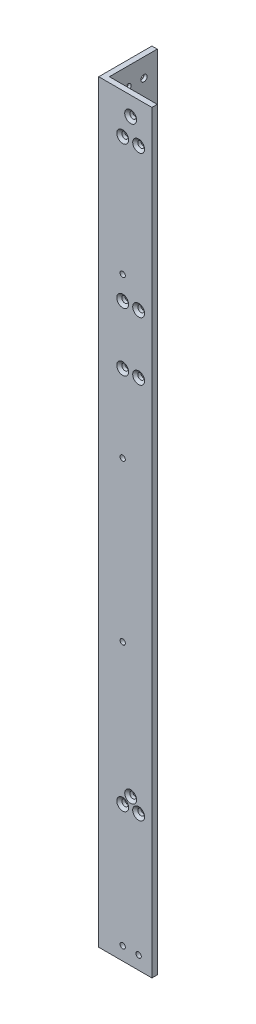
from build123d import *

# Parameters (mm, degrees)
BOSS_EXTRUDE1_DEPTH                               = 450
LEFTSIDEHOLES_SKETCH3_R                           = 1.5875
LEFTSIDEHOLES_CUT_EXTRUDE1_DEPTH                  = 3.175
BACKSIDEHOLES_SKETCH4_R                           = 1.5875
BACKSIDEHOLES_CUT_EXTRUDE2_DEPTH                  = 3.175
CSK_FOR_6_FLAT_HEAD_MACHINE_SCREW_100_D           = 3.7973
CSK_FOR_6_FLAT_HEAD_MACHINE_SCREW_100_CSINK_D     = 7.0866
CSK_FOR_6_FLAT_HEAD_MACHINE_SCREW_100_CSINK_ANGLE = 100
CSK_FOR_6_FLAT_HEAD_MACHINE_SCREW_2_D             = 3.7973
CSK_FOR_6_FLAT_HEAD_MACHINE_SCREW_2_CSINK_D       = 7.0866
CSK_FOR_6_FLAT_HEAD_MACHINE_SCREW_2_CSINK_ANGLE   = 100


with BuildPart() as part:
    # Sketch2 → Boss-Extrude1 (new body)
    with BuildSketch(Plane(origin=(0, 0, 0), x_dir=(1, 0, 0), z_dir=(0, 1, 0))):
        Polygon((0, 31.75), (3.175, 31.75), (3.175, 3.175), (31.75, 3.175), (31.75, 0), (0, 0), align=None)
    extrude(amount=BOSS_EXTRUDE1_DEPTH)

    # LeftSideHoles-Sketch3 → LeftSideHoles-Cut-Extrude1 (cut)
    with BuildSketch(Plane.XY):
        with Locations((14.2875, 81.1125)):
            Circle(LEFTSIDEHOLES_SKETCH3_R)
        with Locations((23.8125, 81.1125)):
            Circle(LEFTSIDEHOLES_SKETCH3_R)
        with Locations((19.05, 87.4625)):
            Circle(LEFTSIDEHOLES_SKETCH3_R)
        with Locations((14.2875, 426.1875)):
            Circle(LEFTSIDEHOLES_SKETCH3_R)
        with Locations((19.05, 438.8875)):
            Circle(LEFTSIDEHOLES_SKETCH3_R)
        with Locations((23.8125, 426.1875)):
            Circle(LEFTSIDEHOLES_SKETCH3_R)
        with Locations((14.2875, 341.24737)):
            Circle(LEFTSIDEHOLES_SKETCH3_R)
        with Locations((23.8125, 341.24737)):
            Circle(LEFTSIDEHOLES_SKETCH3_R)
        with Locations((14.2875, 306.32237)):
            Circle(LEFTSIDEHOLES_SKETCH3_R)
        with Locations((23.8125, 306.32237)):
            Circle(LEFTSIDEHOLES_SKETCH3_R)
        with Locations((14.2875, 7.9375)):
            Circle(LEFTSIDEHOLES_SKETCH3_R)
        with Locations((23.8125, 7.9375)):
            Circle(LEFTSIDEHOLES_SKETCH3_R)
        with Locations((14.2875, 165)):
            Circle(LEFTSIDEHOLES_SKETCH3_R)
        with Locations((14.2875, 260)):
            Circle(LEFTSIDEHOLES_SKETCH3_R)
        with Locations((14.2875, 355)):
            Circle(LEFTSIDEHOLES_SKETCH3_R)
    extrude(amount=-LEFTSIDEHOLES_CUT_EXTRUDE1_DEPTH, mode=Mode.SUBTRACT)

    # BackSideHoles-Sketch4 → BackSideHoles-Cut-Extrude2 (cut)
    with BuildSketch(Plane.ZY):
        with Locations((-19.05, 81.1125)):
            Circle(BACKSIDEHOLES_SKETCH4_R)
        with Locations((-23.8125, 87.4625)):
            Circle(BACKSIDEHOLES_SKETCH4_R)
        with Locations((-14.2875, 87.4625)):
            Circle(BACKSIDEHOLES_SKETCH4_R)
        with Locations((-23.8125, 438.8875)):
            Circle(BACKSIDEHOLES_SKETCH4_R)
        with Locations((-14.2875, 438.8875)):
            Circle(BACKSIDEHOLES_SKETCH4_R)
        with Locations((-19.05, 426.1875)):
            Circle(BACKSIDEHOLES_SKETCH4_R)
        with Locations((-23.8125, 336.74737)):
            Circle(BACKSIDEHOLES_SKETCH4_R)
        with Locations((-14.2875, 336.74737)):
            Circle(BACKSIDEHOLES_SKETCH4_R)
        with Locations((-18.688685449, 330.39737)):
            Circle(BACKSIDEHOLES_SKETCH4_R)
        with Locations((-14.2875, 165)):
            Circle(BACKSIDEHOLES_SKETCH4_R)
        with Locations((-14.2875, 260)):
            Circle(BACKSIDEHOLES_SKETCH4_R)
        with Locations((-23.8125, 7.9375)):
            Circle(BACKSIDEHOLES_SKETCH4_R)
        with Locations((-14.2875, 7.9375)):
            Circle(BACKSIDEHOLES_SKETCH4_R)
        with Locations((-14.2875, 355)):
            Circle(BACKSIDEHOLES_SKETCH4_R)
    extrude(amount=-BACKSIDEHOLES_CUT_EXTRUDE2_DEPTH, mode=Mode.SUBTRACT)

    # CSK for _6 Flat Head Machine Screw _100 (through all)
    with Locations(Plane.ZY):
        with Locations((-14.2875, 438.8875), (-23.8125, 438.8875), (-19.05, 426.1875), (-18.688685449, 330.39737), (-14.2875, 336.74737), (-23.8125, 336.74737), (-19.05, 81.1125), (-14.2875, 87.4625), (-23.8125, 87.4625)):
            CounterSinkHole(CSK_FOR_6_FLAT_HEAD_MACHINE_SCREW_100_D / 2, CSK_FOR_6_FLAT_HEAD_MACHINE_SCREW_100_CSINK_D / 2, counter_sink_angle=CSK_FOR_6_FLAT_HEAD_MACHINE_SCREW_100_CSINK_ANGLE)

    # CSK for _6 Flat Head Machine Screw _ 2 (through all)
    with Locations(Plane.XY):
        with Locations((19.05, 438.8875), (14.2875, 426.1875), (23.8125, 426.1875), (23.8125, 341.24737), (14.2875, 341.24737), (14.2875, 306.32237), (23.8125, 306.32237), (19.05, 87.4625), (14.2875, 81.1125), (23.8125, 81.1125)):
            CounterSinkHole(CSK_FOR_6_FLAT_HEAD_MACHINE_SCREW_2_D / 2, CSK_FOR_6_FLAT_HEAD_MACHINE_SCREW_2_CSINK_D / 2, counter_sink_angle=CSK_FOR_6_FLAT_HEAD_MACHINE_SCREW_2_CSINK_ANGLE)


solid = part.part
